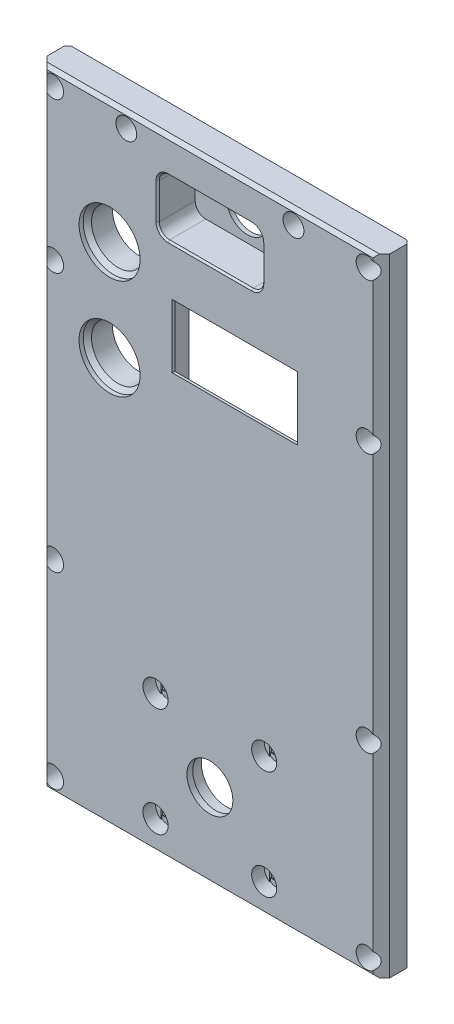
from build123d import *

# Parameters (mm, degrees)
SKETCH1_W                       = 82
SKETCH1_H                       = 150
SKETCH1_W_2                     = 68
SKETCH1_H_2                     = 136
BOSS_EXTRUDE1_DEPTH             = 7
SKETCH2_W                       = 68
SKETCH2_H                       = 36
BOSS_EXTRUDE2_DEPTH             = 7
SKETCH3_R                       = 5.5
CUT_EXTRUDE1_DEPTH              = 86.761296632
SKETCH4_R                       = 6.05
CUT_EXTRUDE2_DEPTH              = 5.6
SKETCH5_R                       = 11.1
CUT_EXTRUDE3_DEPTH              = 3
SKETCH6_R                       = 1.7
CUT_EXTRUDE4_DEPTH              = 86.761296632
SKETCH7_W                       = 50
SKETCH7_H                       = 38
CUT_EXTRUDE5_DEPTH              = 1
SKETCH8_R                       = 3
CUT_EXTRUDE6_DEPTH              = 3
SKETCH9_R                       = 1.45
CUT_EXTRUDE7_DEPTH              = 86.761296632
SKETCH10_R                      = 2.5
CUT_EXTRUDE8_DEPTH              = 5
CHAMFER1_SIZE                   = 2
SKETCH11_W                      = 68
SKETCH11_H                      = 30.5
BOSS_EXTRUDE3_DEPTH             = 7
CUT_EXTRUDE9_DEPTH              = 0.2
SKETCH13_W                      = 2.9
SKETCH13_H                      = 2.9
CUT_EXTRUDE10_DEPTH             = 0.2
CUT_EXTRUDE11_DEPTH             = 0.2
SKETCH15_W                      = 3.4
SKETCH15_H                      = 3.4
CUT_EXTRUDE12_DEPTH             = 0.2
CHAMFER3_SIZE                   = 0.8
SKETCH16_W                      = 2
SKETCH16_H                      = 4
BOSS_EXTRUDE4_DEPTH             = 1
LPATTERN1_COUNT                 = 2
LPATTERN1_PITCH                 = 20
LPATTERN1_COL_COUNT             = 2
LPATTERN1_COL_PITCH             = 20
SKETCH17_R                      = 1.45
CUT_EXTRUDE13_DEPTH             = 86.761296632
SKETCH18_R                      = 2.5
CUT_EXTRUDE14_DEPTH             = 5
CUT_EXTRUDE15_DEPTH             = 0.2
SKETCH20_W                      = 2.9
SKETCH20_H                      = 2.9
CUT_EXTRUDE16_DEPTH             = 0.2
SKIZZE4_W                       = 42
SKIZZE4_H                       = 26.8
SCHNITT_LINEAR_AUSTRAGEN1_DEPTH = 3.2
SKETCH38_W                      = 68
SKETCH38_H                      = 56
BOSS_EXTRUDE12_DEPTH            = 7
SKETCH41_W                      = 68
SKETCH41_H                      = 13.5
BOSS_EXTRUDE13_DEPTH            = 7
SKETCH42_W                      = 36.1
SKETCH42_H                      = 34.2
CUT_EXTRUDE17_DEPTH             = 6.4
SKETCH43_W                      = 30
SKETCH43_H                      = 15.2
CUT_EXTRUDE18_DEPTH             = 86.714409524
SKETCH44_R                      = 6.3
CUT_EXTRUDE19_DEPTH             = 86.761296632
SKETCH45_W                      = 4.85
SKETCH45_H                      = 4.85
BOSS_EXTRUDE14_DEPTH            = 1.8
SKETCH46_R                      = 1.55
BOSS_EXTRUDE15_DEPTH            = 2
SKETCH49_W                      = 25
SKETCH49_H                      = 13.5
CUT_EXTRUDE20_DEPTH             = 86.761296632
SKETCH50_W                      = 29
SKETCH50_H                      = 17.5
SKETCH50_W_2                    = 25
SKETCH50_H_2                    = 13.5
BOSS_EXTRUDE16_DEPTH            = 2
SKETCH51_W                      = 29
SKETCH51_H                      = 17.5
BOSS_EXTRUDE17_DEPTH            = 1
CUT_EXTRUDE21_DEPTH             = 87.058119896
CUT_EXTRUDE21_DEPTH_BACK        = 87.058119896
SKETCH52_R                      = 5
SKETCH53_W                      = 8.4
SKETCH53_H                      = 5
CUT_EXTRUDE22_DEPTH             = 6
SKETCH54_R                      = 7.3
CUT_EXTRUDE23_DEPTH             = 1
CHAMFER4_SIZE                   = 1
FILLET1_R                       = 2.5
CHAMFER5_SIZE                   = 0.4


# Some blends are built 0.0001 mm under size
with BuildPart() as part:
    # Sketch1 → Boss-Extrude1 (new body)
    with BuildSketch(Plane.XY):
        Rectangle(SKETCH1_W, SKETCH1_H)
        Rectangle(SKETCH1_W_2, SKETCH1_H_2, mode=Mode.SUBTRACT)
    extrude(amount=BOSS_EXTRUDE1_DEPTH)

    # Sketch2 → Boss-Extrude2 (add)
    with BuildSketch(Plane.XY.offset(7)):
        with Locations((0, -50)):
            Rectangle(SKETCH2_W, SKETCH2_H)
    extrude(amount=-BOSS_EXTRUDE2_DEPTH)

    # Sketch3 → Cut-Extrude1 (cut, through all)
    with BuildSketch(Plane(origin=(0, 0, 0), x_dir=(-1, 0, 0), z_dir=(0, 0, -1))):
        with Locations((0, -55)):
            Circle(SKETCH3_R)
    extrude(amount=-CUT_EXTRUDE1_DEPTH, mode=Mode.SUBTRACT)

    # Sketch4 → Cut-Extrude2 (cut)
    with BuildSketch(Plane(origin=(0, 0, 0), x_dir=(-1, 0, 0), z_dir=(0, 0, -1))):
        with Locations((0, -55)):
            Circle(SKETCH4_R)
    extrude(amount=-CUT_EXTRUDE2_DEPTH, mode=Mode.SUBTRACT)

    # Sketch5 → Cut-Extrude3 (cut)
    with BuildSketch(Plane(origin=(0, 0, 0), x_dir=(-1, 0, 0), z_dir=(0, 0, -1))):
        with Locations((0, -55)):
            Circle(SKETCH5_R)
    extrude(amount=-CUT_EXTRUDE3_DEPTH, mode=Mode.SUBTRACT)

    # Sketch6 → Cut-Extrude4 (cut, through all)
    with BuildSketch(Plane(origin=(0, 0, 0), x_dir=(-1, 0, 0), z_dir=(0, 0, -1))):
        with Locations((-13, -42)):
            Circle(SKETCH6_R)
        with Locations((13, -42)):
            Circle(SKETCH6_R)
        with Locations((13, -68)):
            Circle(SKETCH6_R)
        with Locations((-13, -68)):
            Circle(SKETCH6_R)
    extrude(amount=-CUT_EXTRUDE4_DEPTH, mode=Mode.SUBTRACT)

    # Sketch7 → Cut-Extrude5 (cut)
    with BuildSketch(Plane(origin=(0, 0, 0), x_dir=(-1, 0, 0), z_dir=(0, 0, -1))):
        with Locations((0, -55)):
            Rectangle(SKETCH7_W, SKETCH7_H)
    extrude(amount=-CUT_EXTRUDE5_DEPTH, mode=Mode.SUBTRACT)

    # Sketch8 → Cut-Extrude6 (cut)
    with BuildSketch(Plane.XY.offset(7)):
        with Locations((-13, -42)):
            Circle(SKETCH8_R)
        with Locations((13, -42)):
            Circle(SKETCH8_R)
        with Locations((13, -68)):
            Circle(SKETCH8_R)
        with Locations((-13, -68)):
            Circle(SKETCH8_R)
    extrude(amount=-CUT_EXTRUDE6_DEPTH, mode=Mode.SUBTRACT)

    # Sketch9 → Cut-Extrude7 (cut, through all)
    with BuildSketch(Plane.XY.offset(7)):
        with Locations((-37.5, 71.5)):
            Circle(SKETCH9_R)
        with Locations((37.5, 71.5)):
            Circle(SKETCH9_R)
        with Locations((37.5, -71.5)):
            Circle(SKETCH9_R)
        with Locations((-37.5, -71.5)):
            Circle(SKETCH9_R)
        with Locations((-37.5, 35.5)):
            Circle(SKETCH9_R)
        with Locations((-37.5, -26.5)):
            Circle(SKETCH9_R)
        with Locations((37.5, -26.5)):
            Circle(SKETCH9_R)
        with Locations((37.5, 35.5)):
            Circle(SKETCH9_R)
    extrude(amount=-CUT_EXTRUDE7_DEPTH, mode=Mode.SUBTRACT)

    # Sketch10 → Cut-Extrude8 (cut)
    with BuildSketch(Plane.XY.offset(7)):
        with Locations((-37.5, 71.5)):
            Circle(SKETCH10_R)
        with Locations((37.5, 71.5)):
            Circle(SKETCH10_R)
        with Locations((-37.5, 35.5)):
            Circle(SKETCH10_R)
        with Locations((-37.5, -26.5)):
            Circle(SKETCH10_R)
        with Locations((-37.5, -71.5)):
            Circle(SKETCH10_R)
        with Locations((37.5, -71.5)):
            Circle(SKETCH10_R)
        with Locations((37.5, 35.5)):
            Circle(SKETCH10_R)
        with Locations((37.5, -26.5)):
            Circle(SKETCH10_R)
    extrude(amount=-CUT_EXTRUDE8_DEPTH, mode=Mode.SUBTRACT)

    # Chamfer1
    # the kernel refuses this chamfer: 2 mm, written as the material it takes off along each edge
    with BuildSketch(Plane(origin=(-41, 80.143365976, 7), x_dir=(-0.027495876610585623, 0, -0.9996219169112968), z_dir=(0, -1, 0)), Plane(origin=(41, -80.143365976, 7), x_dir=(0.027495876610585623, 0, -0.9996219169112968), z_dir=(0, 1, 0))) as chamfer1_piece_1:
        Polygon((CHAMFER1_SIZE * 0.999621916911, CHAMFER1_SIZE * 0.0274958766106), (-CHAMFER1_SIZE * 0.0274958766106, CHAMFER1_SIZE * 0.999621916911), (0, 0), align=None)
    extrude(amount=160.286731952, mode=Mode.SUBTRACT)

    # Sketch11 → Boss-Extrude3 (add)
    with BuildSketch(Plane.XY.offset(7)):
        with Locations((0, -16.75)):
            Rectangle(SKETCH11_W, SKETCH11_H)
    extrude(amount=-BOSS_EXTRUDE3_DEPTH)

    # Sketch12 → Cut-Extrude9 (cut)
    with BuildSketch(Plane.XY.offset(2)):
        with BuildLine():
            Line((-38.95, -73.536541185), (-38.95, -69.463458815))
            ThreePointArc((-38.95, -69.463458815), (-37.5, -69), (-36.05, -69.463458815))
            Line((-36.05, -69.463458815), (-36.05, -73.536541185))
            ThreePointArc((-36.05, -73.536541185), (-37.5, -74), (-38.95, -73.536541185))
        make_face()
        with BuildLine():
            Line((-38.95, -28.536541185), (-38.95, -24.463458815))
            ThreePointArc((-38.95, -24.463458815), (-37.5, -24), (-36.05, -24.463458815))
            Line((-36.05, -24.463458815), (-36.05, -28.536541185))
            ThreePointArc((-36.05, -28.536541185), (-37.5, -29), (-38.95, -28.536541185))
        make_face()
        with BuildLine():
            Line((-38.95, 33.463458815), (-38.95, 37.536541185))
            ThreePointArc((-38.95, 37.536541185), (-37.5, 38), (-36.05, 37.536541185))
            Line((-36.05, 37.536541185), (-36.05, 33.463458815))
            ThreePointArc((-36.05, 33.463458815), (-37.5, 33), (-38.95, 33.463458815))
        make_face()
        with BuildLine():
            Line((-38.95, 69.463458815), (-38.95, 73.536541185))
            ThreePointArc((-38.95, 73.536541185), (-37.5, 74), (-36.05, 73.536541185))
            Line((-36.05, 73.536541185), (-36.05, 69.463458815))
            ThreePointArc((-36.05, 69.463458815), (-37.5, 69), (-38.95, 69.463458815))
        make_face()
    cut_extrude9 = extrude(amount=-CUT_EXTRUDE9_DEPTH, mode=Mode.SUBTRACT)

    # Sketch13 → Cut-Extrude10 (cut)
    with BuildSketch(Plane.XY.offset(1.8)):
        with Locations((-37.5, -71.5)):
            Rectangle(SKETCH13_W, SKETCH13_H)
        with Locations((-37.5, -26.5)):
            Rectangle(SKETCH13_W, SKETCH13_H)
        with Locations((-37.5, 35.5)):
            Rectangle(SKETCH13_W, SKETCH13_H)
        with Locations((-37.5, 71.5)):
            Rectangle(SKETCH13_W, SKETCH13_H)
    cut_extrude10 = extrude(amount=-CUT_EXTRUDE10_DEPTH, mode=Mode.SUBTRACT)

    # Sketch14 → Cut-Extrude11 (cut)
    with BuildSketch(Plane.XY.offset(4)):
        with BuildLine():
            Line((-14.7, -44.471841419), (-14.7, -39.528158581))
            ThreePointArc((-14.7, -39.528158581), (-13, -39), (-11.3, -39.528158581))
            Line((-11.3, -39.528158581), (-11.3, -44.471841419))
            ThreePointArc((-11.3, -44.471841419), (-13, -45), (-14.7, -44.471841419))
        make_face()
        with BuildLine():
            Line((-14.7, -70.471841419), (-14.7, -65.528158581))
            ThreePointArc((-14.7, -65.528158581), (-13, -65), (-11.3, -65.528158581))
            Line((-11.3, -65.528158581), (-11.3, -70.471841419))
            ThreePointArc((-11.3, -70.471841419), (-13, -71), (-14.7, -70.471841419))
        make_face()
    cut_extrude11 = extrude(amount=-CUT_EXTRUDE11_DEPTH, mode=Mode.SUBTRACT)

    # Sketch15 → Cut-Extrude12 (cut)
    with BuildSketch(Plane.XY.offset(3.8)):
        with Locations((-13, -42)):
            Rectangle(SKETCH15_W, SKETCH15_H)
        with Locations((-13, -68)):
            Rectangle(SKETCH15_W, SKETCH15_H)
    cut_extrude12 = extrude(amount=-CUT_EXTRUDE12_DEPTH, mode=Mode.SUBTRACT)

    # Mirror1: Cut-Extrude9, Cut-Extrude10, Cut-Extrude11, Cut-Extrude12 across plane
    add(cut_extrude9.mirror(Plane(origin=(0, 0, 0), x_dir=(0, 0, 1), z_dir=(1, 0, 0))), mode=Mode.SUBTRACT)
    add(cut_extrude10.mirror(Plane(origin=(0, 0, 0), x_dir=(0, 0, 1), z_dir=(1, 0, 0))), mode=Mode.SUBTRACT)
    add(cut_extrude11.mirror(Plane(origin=(0, 0, 0), x_dir=(0, 0, 1), z_dir=(1, 0, 0))), mode=Mode.SUBTRACT)
    add(cut_extrude12.mirror(Plane(origin=(0, 0, 0), x_dir=(0, 0, 1), z_dir=(1, 0, 0))), mode=Mode.SUBTRACT)

    # Chamfer3
    chamfer3_edges = [part.edges().sort_by_distance(p)[0] for p in [
        (0, 75, 7),
        (0, -75, 7),
        (-41, 0, 0),
        (41, 0, 0),
    ]]
    chamfer(chamfer3_edges, length=CHAMFER3_SIZE)

    # Sketch16 → Boss-Extrude4 (add, symmetric)
    # profile 1 of 2: a face of its own
    with BuildSketch(Plane(origin=(0, 0, 0), x_dir=(0, 0, -1), z_dir=(1, 0, 0))):
        Polygon((0, -4), (0, -15.4), (3.2, -12.2), (3.2, -7.2), align=None)
        with Locations((1.6, -9.7)):
            Rectangle(SKETCH16_W, SKETCH16_H, mode=Mode.SUBTRACT)
    # profile 2 of 2: a face of its own
    with BuildSketch(Plane(origin=(0, 0, 0), x_dir=(0, 0, -1), z_dir=(1, 0, 0))):
        Polygon((3.2, -27.6), (0, -30.8), (0, -19.4), (3.2, -22.6), align=None)
        with Locations((1.6, -25.1)):
            Rectangle(SKETCH16_W, SKETCH16_H, mode=Mode.SUBTRACT)
    boss_extrude4 = extrude(amount=BOSS_EXTRUDE4_DEPTH, both=True)

    # LPattern1: Boss-Extrude4 ×2
    with Locations(*[(i * LPATTERN1_PITCH, 0, 0) for i in range(1, LPATTERN1_COUNT)]):
        add(boss_extrude4)

    # LPattern1 col: Boss-Extrude4 ×2
    with Locations(*[(-i * LPATTERN1_COL_PITCH, 0, 0) for i in range(1, LPATTERN1_COL_COUNT)]):
        add(boss_extrude4)

    # Sketch17 → Cut-Extrude13 (cut, through all)
    with BuildSketch(Plane(origin=(0, 0, 0), x_dir=(-1, 0, 0), z_dir=(0, 0, -1))):
        with Locations((-20, 71.5)):
            Circle(SKETCH17_R)
        with Locations((20, 71.5)):
            Circle(SKETCH17_R)
    extrude(amount=-CUT_EXTRUDE13_DEPTH, mode=Mode.SUBTRACT)

    # Sketch18 → Cut-Extrude14 (cut)
    with BuildSketch(Plane.XY.offset(7)):
        with Locations((-20, 71.5)):
            Circle(SKETCH18_R)
        with Locations((20, 71.5)):
            Circle(SKETCH18_R)
    extrude(amount=-CUT_EXTRUDE14_DEPTH, mode=Mode.SUBTRACT)

    # Sketch19 → Cut-Extrude15 (cut)
    with BuildSketch(Plane.XY.offset(2)):
        with BuildLine():
            Line((-21.45, 69.463458815), (-21.45, 73.536541185))
            ThreePointArc((-21.45, 73.536541185), (-20, 74), (-18.55, 73.536541185))
            Line((-18.55, 73.536541185), (-18.55, 69.463458815))
            ThreePointArc((-18.55, 69.463458815), (-20, 69), (-21.45, 69.463458815))
        make_face()
        with BuildLine():
            Line((18.55, 69.463458815), (18.55, 73.536541185))
            ThreePointArc((18.55, 73.536541185), (20, 74), (21.45, 73.536541185))
            Line((21.45, 73.536541185), (21.45, 69.463458815))
            ThreePointArc((21.45, 69.463458815), (20, 69), (18.55, 69.463458815))
        make_face()
    extrude(amount=-CUT_EXTRUDE15_DEPTH, mode=Mode.SUBTRACT)

    # Sketch20 → Cut-Extrude16 (cut)
    with BuildSketch(Plane.XY.offset(1.8)):
        with Locations((-20, 71.5)):
            Rectangle(SKETCH20_W, SKETCH20_H)
        with Locations((20, 71.5)):
            Rectangle(SKETCH20_W, SKETCH20_H)
    extrude(amount=-CUT_EXTRUDE16_DEPTH, mode=Mode.SUBTRACT)

    # Skizze4 → Schnitt-Linear austragen1 (cut)
    with BuildSketch(Plane(origin=(0, 0, 0), x_dir=(-1, 0, 0), z_dir=(0, 0, -1))):
        with Locations((0, -17.4)):
            Rectangle(SKIZZE4_W, SKIZZE4_H)
    extrude(amount=SCHNITT_LINEAR_AUSTRAGEN1_DEPTH, mode=Mode.SUBTRACT)

    # Sketch38 → Boss-Extrude12 (add)
    with BuildSketch(Plane.XY.offset(7)):
        with Locations((0, 40)):
            Rectangle(SKETCH38_W, SKETCH38_H)
    extrude(amount=-BOSS_EXTRUDE12_DEPTH)

    # Sketch41 → Boss-Extrude13 (add)
    with BuildSketch(Plane.XY.offset(7)):
        with Locations((0, 5.25)):
            Rectangle(SKETCH41_W, SKETCH41_H)
    extrude(amount=-BOSS_EXTRUDE13_DEPTH)

    # Sketch42 → Cut-Extrude17 (cut)
    with BuildSketch(Plane(origin=(0, 0, 0), x_dir=(-1, 0, 0), z_dir=(0, 0, -1))):
        with Locations((-6, 32.1)):
            Rectangle(SKETCH42_W, SKETCH42_H)
    extrude(amount=-CUT_EXTRUDE17_DEPTH, mode=Mode.SUBTRACT)

    # Sketch43 → Cut-Extrude18 (cut, through all)
    with BuildSketch(Plane(origin=(0, 0, 6.4), x_dir=(-1, 0, 0), z_dir=(0, 0, -1))):
        with Locations((-6, 34)):
            Rectangle(SKETCH43_W, SKETCH43_H)
    extrude(amount=-CUT_EXTRUDE18_DEPTH, mode=Mode.SUBTRACT)

    # Sketch44 → Cut-Extrude19 (cut, through all)
    with BuildSketch(Plane(origin=(0, 0, 0), x_dir=(-1, 0, 0), z_dir=(0, 0, -1))):
        with Locations((24, 22)):
            Circle(SKETCH44_R)
        with Locations((24, 46)):
            Circle(SKETCH44_R)
    extrude(amount=-CUT_EXTRUDE19_DEPTH, mode=Mode.SUBTRACT)

    # Sketch45 → Boss-Extrude14 (add)
    with BuildSketch(Plane(origin=(0, 0, 6.4), x_dir=(-1, 0, 0), z_dir=(0, 0, -1))):
        with Locations((-21.625, 46.775)):
            Rectangle(SKETCH45_W, SKETCH45_H)
        with Locations((9.625, 46.775)):
            Rectangle(SKETCH45_W, SKETCH45_H)
        with Locations((9.625, 17.425)):
            Rectangle(SKETCH45_W, SKETCH45_H)
        with Locations((-21.625, 17.425)):
            Rectangle(SKETCH45_W, SKETCH45_H)
    extrude(amount=BOSS_EXTRUDE14_DEPTH)

    # Sketch46 → Boss-Extrude15 (add)
    with BuildSketch(Plane(origin=(0, 0, 4.6), x_dir=(-1, 0, 0), z_dir=(0, 0, -1))):
        with Locations((9.2, 17.85)):
            Circle(SKETCH46_R)
        with Locations(Location((-21.2, 17.85, 0), (0, 0, 180))):
            Circle(SKETCH46_R)
        with Locations((-21.2, 46.35)):
            Circle(SKETCH46_R)
        with Locations(Location((9.2, 46.35, 0), (0, 0, 180))):
            Circle(SKETCH46_R)
    extrude(amount=BOSS_EXTRUDE15_DEPTH)

    # Sketch49 → Cut-Extrude20 (cut, through all)
    with BuildSketch(Plane.XY.offset(7)):
        with Locations((0, 60)):
            Rectangle(SKETCH49_W, SKETCH49_H)
    extrude(amount=-CUT_EXTRUDE20_DEPTH, mode=Mode.SUBTRACT)

    # Sketch50 → Boss-Extrude16 (add)
    with BuildSketch(Plane(origin=(0, 0, 0), x_dir=(-1, 0, 0), z_dir=(0, 0, -1))):
        with Locations((0, 60)):
            Rectangle(SKETCH50_W, SKETCH50_H)
        with Locations((0, 60)):
            Rectangle(SKETCH50_W_2, SKETCH50_H_2, mode=Mode.SUBTRACT)
    extrude(amount=BOSS_EXTRUDE16_DEPTH)

    # Sketch51 → Boss-Extrude17 (add)
    with BuildSketch(Plane(origin=(0, 0, -2), x_dir=(-1, 0, 0), z_dir=(0, 0, -1))):
        with Locations((0, 60)):
            Rectangle(SKETCH51_W, SKETCH51_H)
    extrude(amount=BOSS_EXTRUDE17_DEPTH)

    # Sketch52 → Cut-Extrude21 (cut, two sides: drawn at the far end of the back side and taken through both)
    with BuildSketch(Plane(origin=(0, 0, -3), x_dir=(-1, 0, 0), z_dir=(0, 0, -1)).offset(-CUT_EXTRUDE21_DEPTH_BACK)):
        with Locations((0, 60)):
            Circle(SKETCH52_R)
    extrude(amount=CUT_EXTRUDE21_DEPTH + CUT_EXTRUDE21_DEPTH_BACK, mode=Mode.SUBTRACT)

    # Sketch53 → Cut-Extrude22 (cut)
    with BuildSketch(Plane.ZY.offset(-12.5)):
        with Locations((2.2, 60)):
            Rectangle(SKETCH53_W, SKETCH53_H)
    extrude(amount=-CUT_EXTRUDE22_DEPTH, mode=Mode.SUBTRACT)

    # Sketch54 → Cut-Extrude23 (cut)
    with BuildSketch(Plane.XY.offset(7)):
        with Locations((-24, 46)):
            Circle(SKETCH54_R)
        with Locations((-24, 22)):
            Circle(SKETCH54_R)
    extrude(amount=-CUT_EXTRUDE23_DEPTH, mode=Mode.SUBTRACT)

    # Chamfer4
    chamfer4_edges = [part.edges().sort_by_distance(p)[0] for p in [
        (-17.7, 46, 6),
        (-17.7, 22, 6),
    ]]
    chamfer(chamfer4_edges, length=CHAMFER4_SIZE - 0.0001)  # a hair under: the kernel refuses the full size

    # Fillet1
    fillet1_edges = [part.edges().sort_by_distance(p)[0] for p in [
        (12.5, 66.75, 3.5),
        (12.5, 53.25, 3.5),
        (-12.5, 53.25, 3.5),
        (-12.5, 66.75, 3.5),
    ]]
    fillet(fillet1_edges, radius=FILLET1_R)

    # Chamfer5
    chamfer5_edges = [part.edges().sort_by_distance(p)[0] for p in [
        (12.5, 60, 7),
        (0, 53.25, 7),
        (-12.5, 60, 7),
        (0, 66.75, 7),
        (11.767766953, 53.982233047, 7),
        (-11.767766953, 53.982233047, 7),
        (11.767766953, 66.017766953, 7),
        (-11.767766953, 66.017766953, 7),
    ]]
    chamfer(chamfer5_edges, length=CHAMFER5_SIZE)


solid = part.part
